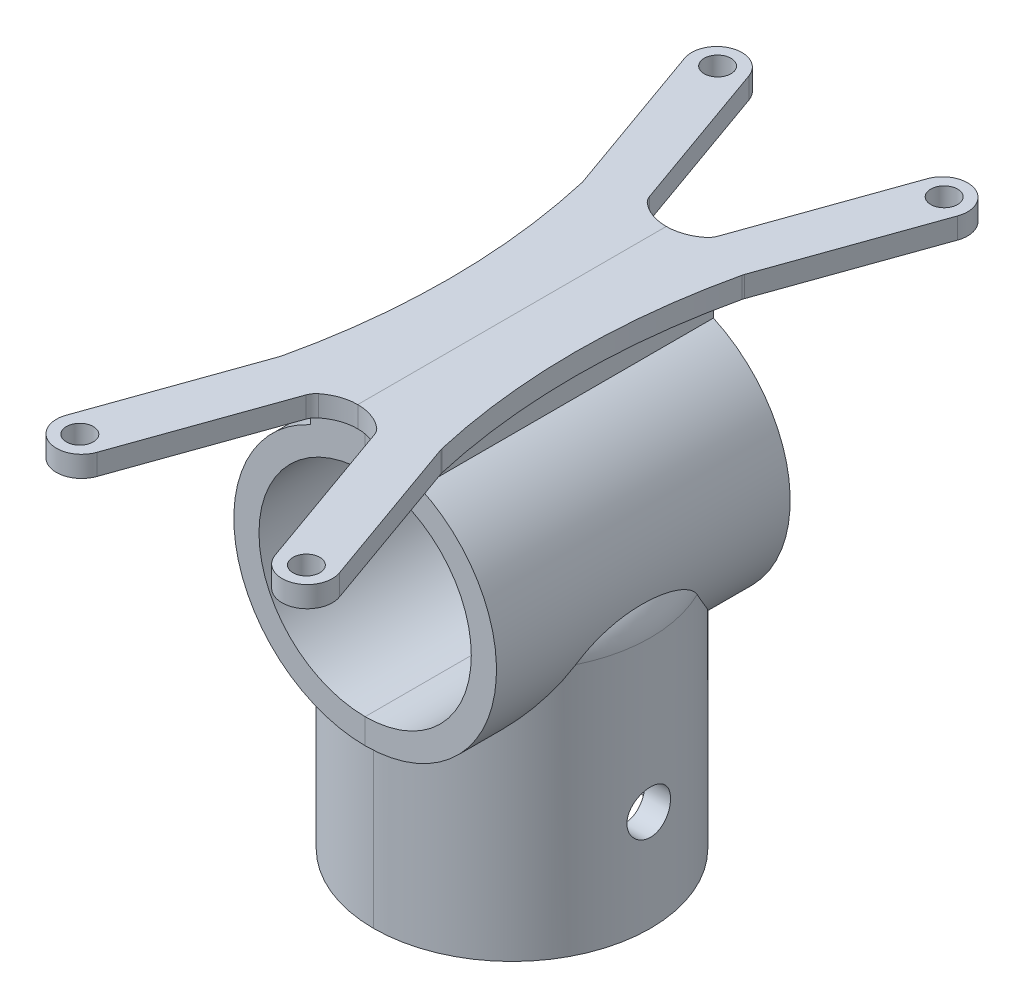
from build123d import *
from build123d.topology import SkipClean

# Parameters (mm, degrees)
SKETCH1_R                = 15.65
SKETCH1_R_2              = 12.65
BOSS_EXTRUDE1_DEPTH      = 17.5
SKETCH5_R                = 1.6
BOSS_EXTRUDE4_DEPTH      = 2.5
FILLET1_R                = 2
BOSS_EXTRUDE5_REACH      = 57.116
BOSS_EXTRUDE5_END_RADIUS = 15.65
SKETCH6_W                = 13
SKETCH6_H                = 35
SKETCH2_R                = 16.5
SKETCH2_R_2              = 13.5
BOSS_EXTRUDE7_DEPTH      = 35
SKETCH7_R                = 12.65
CUT_EXTRUDE2_DEPTH       = 71.010781511
FILLET2_R                = 5
SKETCH8_R                = 2.6
CUT_EXTRUDE3_DEPTH       = 17.5


with BuildPart() as part:
    # Sketch1 → Boss-Extrude1 (new, symmetric)
    with BuildSketch(Plane.XY):
        Circle(SKETCH1_R)
        Circle(SKETCH1_R_2, mode=Mode.SUBTRACT)
    extrude(amount=BOSS_EXTRUDE1_DEPTH, both=True)



with BuildPart() as body_2:
    # Sketch5 → Boss-Extrude4 (new body)
    # profile 1 of 5: a face of its own
    with BuildSketch(Plane(origin=(0, 20, 0), x_dir=(1, 0, 0), z_dir=(0, 1, 0))):
        with BuildLine():
            Line((-9.576904887, -17.995704843), (-16.272205934, -36.84173742))
            ThreePointArc((-16.272205934, -36.84173742), (-14.449596204, -40.672937463), (-10.618396161, -38.850327734))
            Line((-10.618396161, -38.850327734), (-3.923095113, -20.004295157))
            Line((-3.923095113, -20.004295157), (0, -8.961508912))
            Line((0, -8.961508912), (3.923095113, -20.004295157))
            Line((3.923095113, -20.004295157), (10.618396161, -38.850327734))
            ThreePointArc((10.618396161, -38.850327734), (14.449596204, -40.672937463), (16.272205934, -36.84173742))
            Line((16.272205934, -36.84173742), (9.576904887, -17.995704843))
            Line((9.576904887, -17.995704843), (3.183693955, 0))
            Line((3.183693955, 0), (9.576904887, 17.995704843))
            Line((9.576904887, 17.995704843), (16.272205934, 36.84173742))
            ThreePointArc((16.272205934, 36.84173742), (14.449596204, 40.672937463), (10.618396161, 38.850327734))
            Line((10.618396161, 38.850327734), (3.923095113, 20.004295157))
            Line((3.923095113, 20.004295157), (0, 8.961508912))
            Line((0, 8.961508912), (-3.923095113, 20.004295157))
            Line((-3.923095113, 20.004295157), (-10.618396161, 38.850327734))
            ThreePointArc((-10.618396161, 38.850327734), (-14.449596204, 40.672937463), (-16.272205934, 36.84173742))
            Line((-16.272205934, 36.84173742), (-9.576904887, 17.995704843))
            Line((-9.576904887, 17.995704843), (-3.183693955, 0))
            Line((-3.183693955, 0), (-9.576904887, -17.995704843))
        make_face()
        with Locations(Location((13.5, -38, 0), (0, 0, 270))):
            Circle(SKETCH5_R, mode=Mode.SUBTRACT)
        with Locations(Location((-13.5, -38, 0), (0, 0, 270))):
            Circle(SKETCH5_R, mode=Mode.SUBTRACT)
        with Locations(Location((13.5, 38, 0), (0, 0, 270))):
            Circle(SKETCH5_R, mode=Mode.SUBTRACT)
        with Locations(Location((-13.5, 38, 0), (0, 0, 270))):
            Circle(SKETCH5_R, mode=Mode.SUBTRACT)
    # profile 2 of 5: a face of its own
    with BuildSketch(Plane(origin=(0, 20, 0), x_dir=(1, 0, 0), z_dir=(0, 1, 0))):
        with BuildLine():
            Line((-9.576904887, 17.995704843), (-3.183693955, 0))
            Line((-3.183693955, 0), (-9.576904887, -17.995704843))
            ThreePointArc((-9.576904887, -17.995704843), (-7.526597684, 0), (-9.576904887, 17.995704843))
        make_face()
    # profile 3 of 5: a face of its own
    with BuildSketch(Plane(origin=(0, 20, 0), x_dir=(1, 0, 0), z_dir=(0, 1, 0))):
        with BuildLine():
            ThreePointArc((9.576904887, 17.995704843), (7.526597684, 0), (9.576904887, -17.995704843))
            Line((9.576904887, -17.995704843), (3.183693955, 0))
            Line((3.183693955, 0), (9.576904887, 17.995704843))
        make_face()
    # profile 4 of 5: a face of its own
    with BuildSketch(Plane(origin=(0, 20, 0), x_dir=(1, 0, 0), z_dir=(0, 1, 0))):
        with BuildLine():
            Line((-3.923095113, -20.004295157), (0, -8.961508912))
            Line((0, -8.961508912), (3.923095113, -20.004295157))
            ThreePointArc((3.923095113, -20.004295157), (0, -18.380084852), (-3.923095113, -20.004295157))
        make_face()
    # profile 5 of 5: a face of its own
    with BuildSketch(Plane(origin=(0, 20, 0), x_dir=(1, 0, 0), z_dir=(0, 1, 0))):
        with BuildLine():
            ThreePointArc((-3.923095113, 20.004295157), (0, 18.380084852), (3.923095113, 20.004295157))
            Line((3.923095113, 20.004295157), (0, 8.961508912))
            Line((0, 8.961508912), (-3.923095113, 20.004295157))
        make_face()
    extrude(amount=-BOSS_EXTRUDE4_DEPTH)

    # Fillet1
    fillet1_edges = [body_2.edges().sort_by_distance(p)[0] for p in [
        (-9.576904887, 18.75, -17.995704843),
        (-3.923095113, 18.75, -20.004295157),
        (3.923095113, 18.75, -20.004295157),
        (9.576904887, 18.75, -17.995704843),
        (9.576904887, 18.75, 17.995704843),
        (3.923095113, 18.75, 20.004295157),
        (-3.923095113, 18.75, 20.004295157),
        (-9.576904887, 18.75, 17.995704843),
    ]]
    fillet(fillet1_edges, radius=FILLET1_R)


with BuildPart() as part_1:
    add(part.part)

    add(body_2.part)  # Boss-Extrude5 merges body 2
    # Boss-Extrude5: up to this cylinder (the profile starts outside it)
    boss_extrude5_end = Plane(origin=(0, 0, 0), z_dir=(0, 0, -1)) * Cylinder(BOSS_EXTRUDE5_END_RADIUS, 146.532, mode=Mode.PRIVATE)
    # Sketch6 → Boss-Extrude5 (add, up to the surface)
    with BuildSketch(Plane.XZ.offset(-17.5), mode=Mode.PRIVATE) as boss_extrude5_sk1:
        Rectangle(SKETCH6_W, SKETCH6_H)
    boss_extrude5_tool1 = extrude(boss_extrude5_sk1.sketch, amount=BOSS_EXTRUDE5_REACH, mode=Mode.PRIVATE) - boss_extrude5_end
    add(boss_extrude5_tool1.solids().sort_by_distance((0, 17.5, 0))[0])

    # Sketch2 → Boss-Extrude7 (add)
    with BuildSketch(Plane(origin=(0, -35, 0), x_dir=(1, 0, 0), z_dir=(0, 1, 0))):
        with Locations(Location((0, 0, 0), (0, 0, 161.529128841))):
            Circle(SKETCH2_R)
        with Locations(Location((0, 0, 0), (0, 0, 90))):
            Circle(SKETCH2_R_2, mode=Mode.SUBTRACT)
    extrude(amount=BOSS_EXTRUDE7_DEPTH)

    # Sketch7 → Cut-Extrude2 (cut, through all)
    with SkipClean():  # the faces are left unmerged after this step: merging them gives an invalid solid
        with BuildSketch(Plane.XY.offset(17.5)):
            Circle(SKETCH7_R)
        extrude(amount=-CUT_EXTRUDE2_DEPTH, mode=Mode.SUBTRACT)

    # Fillet2
    # the kernel refuses this fillet: 5 mm, written as the material it takes off along each edge
    with BuildSketch(Plane(origin=(0, 0, 0), x_dir=(-0.4713243638223913, 0, -0.8819599447069114), z_dir=(0.8819599447069114, 0, -0.4713243638223913))) as fillet2_piece_1_section:
        with BuildLine():
            CenterArc((16.5 - FILLET2_R, -FILLET2_R), FILLET2_R, 0, 90)
            Line((16.5, -FILLET2_R), (16.5, 0))
            Line((16.5, 0), (16.5 - FILLET2_R, 0))
        make_face()
    fillet2_piece_1 = revolve(axis=Axis((0, 0, 0), (0, 1, 0)), revolution_arc=123.759403508, mode=Mode.PRIVATE)
    fillet2_piece_1 = fillet2_piece_1 - Plane(origin=(0, 0, -1.707e-05), x_dir=(1, 0, 0), z_dir=(0, 0, 1)) * Cylinder(15.65, 66, mode=Mode.PRIVATE)
    add(fillet2_piece_1, mode=Mode.SUBTRACT)
    with BuildSketch(Plane(origin=(0, 0, 0), x_dir=(0.47132436381735604, 0, 0.8819599447096023), z_dir=(-0.8819599447096023, 0, 0.47132436381735604))) as fillet2_piece_2_section:
        with BuildLine():
            CenterArc((16.5 - FILLET2_R, -FILLET2_R), FILLET2_R, 0, 90)
            Line((16.5 - FILLET2_R, 0), (16.5, 0))
            Line((16.5, 0), (16.5, -FILLET2_R))
        make_face()
    fillet2_piece_2 = revolve(axis=Axis((0, 0, 0), (0, 1, 0)), revolution_arc=123.759403508, mode=Mode.PRIVATE)
    fillet2_piece_2 = fillet2_piece_2 - Plane(origin=(0, 0, 6.15e-07), x_dir=(1, 0, 0), z_dir=(0, 0, 1)) * Cylinder(15.65, 67, mode=Mode.PRIVATE)
    add(fillet2_piece_2, mode=Mode.SUBTRACT)

    # Sketch8 → Cut-Extrude3 (cut, symmetric)
    with BuildSketch(Plane(origin=(0, 0, 0), x_dir=(0, 0, -1), z_dir=(1, 0, 0))):
        with Locations((0, -23)):
            Circle(SKETCH8_R)
    extrude(amount=CUT_EXTRUDE3_DEPTH, both=True, mode=Mode.SUBTRACT)


with BuildPart() as body_2_2:
    # Split1: the piece on the far side of the plane
    add(part_1.part)
    split(bisect_by=Plane(origin=(0, 0, 0), x_dir=(0, 0, 1), z_dir=(1, 0, 0)), keep=Keep.BOTTOM)


with BuildPart() as part_2:
    add(part_1.part)

    # Split1
    split(bisect_by=Plane(origin=(0, 0, 0), x_dir=(0, 0, 1), z_dir=(1, 0, 0)), keep=Keep.TOP)


solid = Compound([body_2_2.part, part_2.part])
